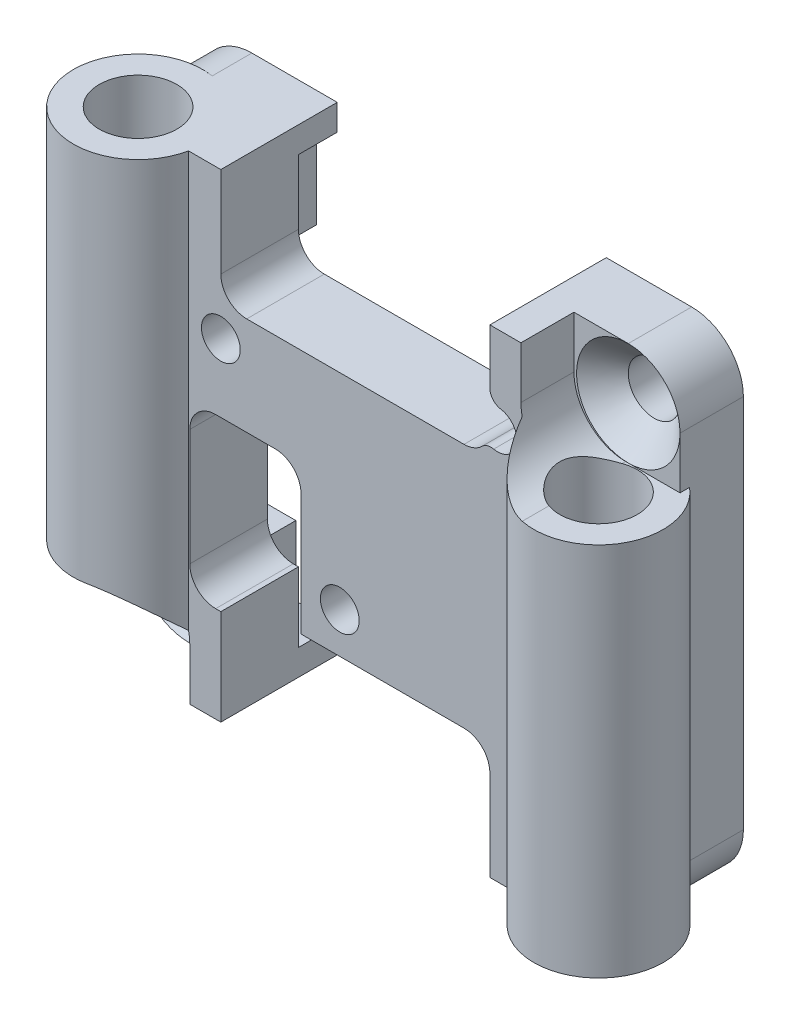
from build123d import *

# Parameters (mm, degrees)
BOSS_EXTRUDE1_DEPTH          = 1.5
BOSS_EXTRUDE1_2_DEPTH        = 1.5
BOSS_EXTRUDE2_DEPTH          = 3
FILLET1_R                    = 1
SKETCH3_R                    = 0.75
CUT_EXTRUDE2_DEPTH           = 29.346075566
FILLET2_R                    = 0.5
BOSS_EXTRUDE3_REACH          = 30.346
SKETCH4_R                    = 2.5
SKETCH4_R_2                  = 1.5
CUT_EXTRUDE3_DEPTH           = 29.731515957
CUT_EXTRUDE5_START           = -4
CUT_EXTRUDE5_DEPTH           = 4
SKETCH7_R                    = 1
CUT_EXTRUDE6_DEPTH           = 29.952763407
CHAMFER1_SIZE                = 1
CIRPATTERN1_COUNT            = 2
CHAMFER1_OF_CIRPATTERN1_SIZE = 1
FILLET3_R                    = 2


# Some blends are built 0.0001 mm under size
with BuildPart() as part:
    # Sketch1 → Boss-Extrude1 (new body)
    with BuildSketch(Plane.XY):
        with BuildLine():
            Line((2, 0), (5.3, 0))
            Line((5.3, 0), (5.3, 1))
            Line((5.3, 1), (3.7, 1))
            Line((3.7, 1), (3.7, 3.7))
            Line((3.7, 3.7), (1, 3.7))
            Line((1, 3.7), (1, 14))
            Line((1, 14), (4.5, 14))
            Line((4.5, 14), (4.5, 17.5))
            Line((4.5, 17.5), (5.3, 17.5))
            Line((5.3, 17.5), (5.3, 18.5))
            Line((5.3, 18.5), (2, 18.5))
            ThreePointArc((2, 18.5), (0.585786438, 17.914213562), (0, 16.5))
            Line((0, 16.5), (0, 2))
            ThreePointArc((0, 2), (0.585786438, 0.585786438), (2, 0))
        make_face()
    extrude(amount=BOSS_EXTRUDE1_DEPTH)



with BuildPart() as body_2:
    # Sketch1 → Boss-Extrude1 2 (new body)
    with BuildSketch(Plane.XY):
        with BuildLine():
            Line((21, 2), (21, 16.5))
            ThreePointArc((21, 16.5), (20.414213562, 17.914213562), (19, 18.5))
            Line((19, 18.5), (15.7, 18.5))
            Line((15.7, 18.5), (15.7, 17.5))
            Line((15.7, 17.5), (16.5, 17.5))
            Line((16.5, 17.5), (16.5, 14))
            Line((16.5, 14), (20, 14))
            Line((20, 14), (20, 2))
            ThreePointArc((20, 2), (19.707106781, 1.292893219), (19, 1))
            Line((19, 1), (15.7, 1))
            Line((15.7, 1), (15.7, 0))
            Line((15.7, 0), (19, 0))
            ThreePointArc((19, 0), (20.414213562, 0.585786438), (21, 2))
        make_face()
    extrude(amount=BOSS_EXTRUDE1_2_DEPTH)


with BuildPart() as part_1:
    add(part.part)

    add(body_2.part)  # Boss-Extrude2 merges body 2
    # Sketch2 → Boss-Extrude2 (add)
    with BuildSketch(Plane.XY.offset(1.5)):
        with BuildLine():
            Line((19, 18.5), (15.7, 18.5))
            Line((15.7, 18.5), (15.7, 14))
            Line((15.7, 14), (5.3, 14))
            Line((5.3, 14), (5.3, 18.5))
            Line((5.3, 18.5), (2, 18.5))
            ThreePointArc((2, 18.5), (0.585786438, 17.914213562), (0, 16.5))
            Line((0, 16.5), (0, 2))
            ThreePointArc((0, 2), (0.585786438, 0.585786438), (2, 0))
            Line((2, 0), (5.3, 0))
            Line((5.3, 0), (5.3, 3.7))
            Line((5.3, 3.7), (4.1, 3.7))
            Line((4.1, 3.7), (4.1, 10.2))
            Line((4.1, 10.2), (8.4, 10.2))
            Line((8.4, 10.2), (8.4, 4.5))
            Line((8.4, 4.5), (15.7, 4.5))
            Line((15.7, 4.5), (15.7, 0))
            Line((15.7, 0), (19, 0))
            ThreePointArc((19, 0), (20.414213562, 0.585786438), (21, 2))
            Line((21, 2), (21, 16.5))
            ThreePointArc((21, 16.5), (20.414213562, 17.914213562), (19, 18.5))
        make_face()
    extrude(amount=BOSS_EXTRUDE2_DEPTH)

    # Fillet1
    fillet1_edges = [part_1.edges().sort_by_distance(p)[0] for p in [
        (15.7, 14, 3),
        (5.3, 14, 3),
        (4.1, 3.7, 3),
        (4.1, 10.2, 3),
        (8.4, 10.2, 3),
        (15.7, 4.5, 3),
    ]]
    fillet(fillet1_edges, radius=FILLET1_R)

    # Sketch3 → Cut-Extrude2 (cut, through all)
    with BuildSketch(Plane.XY.offset(4.5)):
        with Locations((9.898564471, 6.065663219)):
            Circle(SKETCH3_R)
        with Locations((5.3005196, 12.837006018)):
            Circle(SKETCH3_R)
        with Locations((16, 15.15)):
            Circle(SKETCH3_R)
    extrude(amount=-CUT_EXTRUDE2_DEPTH, mode=Mode.SUBTRACT)

    # Fillet2
    fillet2_edges = [part_1.edges().sort_by_distance(p)[0] for p in [
        (15.581422532, 14.527671386, 3),
        (15.7, 15.837386354, 3),
    ]]
    fillet(fillet2_edges, radius=FILLET2_R)

    # Boss-Extrude3: up to this face of the body (flat: up to its plane)
    boss_extrude3_end = Plane(part_1.part.faces().sort_by_distance((3.65, 18.5, 2.25))[0])
    # Sketch4 → Boss-Extrude3 (add, up to the picked face)
    with BuildSketch(Plane.XZ, mode=Mode.PRIVATE) as boss_extrude3_sk1:
        with Locations((1.6, 4)):
            Circle(SKETCH4_R)
        with Locations((1.6, 4)):
            Circle(SKETCH4_R_2, mode=Mode.SUBTRACT)
    boss_extrude3_tool1 = split(extrude(boss_extrude3_sk1.sketch, amount=-BOSS_EXTRUDE3_REACH, mode=Mode.PRIVATE), bisect_by=boss_extrude3_end, keep=Keep.BOTH, mode=Mode.PRIVATE)
    boss_extrude3 = boss_extrude3_tool1.solids().sort_by(Axis((-0.829289, 0, 4), (0, 1, 0)))[0]
    add(boss_extrude3)

    # Sketch4<2> → Cut-Extrude3 (cut, through all)
    with BuildSketch(Plane.XZ):
        with BuildLine():
            Line((2, 4.5), (3.014213562, 4.5))
            ThreePointArc((3.014213562, 4.5), (0.269863345, 4.693351628), (2, 2.554316771))
            Line((2, 2.554316771), (2, 4.5))
        make_face()
        with BuildLine():
            ThreePointArc((3.1, 4), (3.078397839, 4.253652968), (3.014213562, 4.5))
            Line((3.014213562, 4.5), (2, 4.5))
            Line((2, 4.5), (2, 2.554316771))
            ThreePointArc((2, 2.554316771), (2.793733639, 3.091704894), (3.1, 4))
        make_face()
    cut_extrude3 = extrude(amount=-CUT_EXTRUDE3_DEPTH, mode=Mode.SUBTRACT)

    # Mirror1: Boss-Extrude3, Cut-Extrude3 across plane
    add(boss_extrude3.mirror(Plane.ZY.offset(-10.5)))
    add(cut_extrude3.mirror(Plane.ZY.offset(-10.5)), mode=Mode.SUBTRACT)

    # Sketch6 → Cut-Extrude5 (cut)
    with BuildSketch(Plane(origin=(0, 18.5, 0), x_dir=(1, 0, 0), z_dir=(0, 1, 0)).offset(CUT_EXTRUDE5_START)):
        with BuildLine():
            Line((21.9, -2.45), (16.9, -2.45))
            Line((16.9, -2.45), (16.9, -4.5))
            Line((16.9, -4.5), (17.092307692, -4.961538462))
            ThreePointArc((17.092307692, -4.961538462), (19.890290338, -6.451451689), (21.9, -4))
            Line((21.9, -4), (21.9, -2.45))
        make_face()
    cut_extrude5 = extrude(amount=CUT_EXTRUDE5_DEPTH, mode=Mode.SUBTRACT)

    # Sketch7 → Cut-Extrude6 (cut, symmetric)
    with BuildSketch(Plane.XY.offset(2.45)):
        with Locations((19, 16.5)):
            Circle(SKETCH7_R)
        with BuildLine():
            Line((21, 14.5), (21, 16.5))
            ThreePointArc((21, 16.5), (20.414213562, 17.914213562), (19, 18.5))
            Line((19, 18.5), (16.9, 18.5))
            Line((16.9, 18.5), (16.9, 19.5))
            Line((16.9, 19.5), (22, 19.5))
            Line((22, 19.5), (22, 14.5))
            Line((22, 14.5), (21, 14.5))
        make_face()
    cut_extrude6 = extrude(amount=CUT_EXTRUDE6_DEPTH, both=True, mode=Mode.SUBTRACT)

    # Chamfer1
    chamfer1_edges = [part_1.edges().sort_by_distance(p)[0] for p in [
        (18, 16.5, 2.45),
    ]]
    chamfer(chamfer1_edges, length=CHAMFER1_SIZE - 0.0001)  # a hair under: the kernel refuses the full size

    # CirPattern1: Cut-Extrude5, Cut-Extrude6 ×2 about axis
    cirpattern1_axis = Axis((10.5, 9.25, 0), (0, 0, 1))
    add([cut_extrude5.rotate(cirpattern1_axis, i * 360 / CIRPATTERN1_COUNT) for i in range(1, CIRPATTERN1_COUNT)], mode=Mode.SUBTRACT)
    add([cut_extrude6.rotate(cirpattern1_axis, i * 360 / CIRPATTERN1_COUNT) for i in range(1, CIRPATTERN1_COUNT)], mode=Mode.SUBTRACT)

    # Chamfer1 of CirPattern1
    chamfer1_of_cirpattern1_edges = [part_1.edges().sort_by_distance(p)[0] for p in [
        (3, 2, 2.45),
    ]]
    chamfer(chamfer1_of_cirpattern1_edges, length=CHAMFER1_OF_CIRPATTERN1_SIZE - 0.0001)  # a hair under: the kernel refuses the full size

    # Fillet3
    # the kernel refuses this fillet: 2 mm, written as the material it adds along each edge
    with BuildSketch(Plane(origin=(4.1, 4, -2.55), x_dir=(-1, 0, 0), z_dir=(0, 0, 1))) as fillet3_piece_1_section:
        with BuildLine():
            CenterArc((FILLET3_R, FILLET3_R), FILLET3_R, 180, 90)
            Line((0, FILLET3_R), (0, 0))
            Line((0, 0), (FILLET3_R, 0))
        make_face()
    fillet3_piece_1 = extrude(amount=7.05, mode=Mode.PRIVATE)
    fillet3_piece_1 = split(fillet3_piece_1, bisect_by=Plane(origin=(3.649361997, 3.29823616, 1.5), z_dir=(0, 0, 1)), keep=Keep.TOP, mode=Mode.PRIVATE)
    fillet3_piece_1 = fillet3_piece_1 - Plane(origin=(1.6, 3.29823616, 4), x_dir=(1, 0, 0), z_dir=(0, -1, 0)) * Cylinder(1.5, 23, mode=Mode.PRIVATE)
    add(fillet3_piece_1)
    with BuildSketch(Plane(origin=(4.1, 4, -2.55), x_dir=(-1, 0, 0), z_dir=(0, 0, 1))) as fillet3_piece_2_section:
        with BuildLine():
            CenterArc((FILLET3_R, FILLET3_R), FILLET3_R, 180, 90)
            Line((0, FILLET3_R), (0, 0))
            Line((0, 0), (FILLET3_R, 0))
        make_face()
    fillet3_piece_2 = extrude(amount=12.05, mode=Mode.PRIVATE)
    fillet3_piece_2 = fillet3_piece_2 & Plane(origin=(1.6, 3.552217846, 4), x_dir=(1, 0, 0), z_dir=(0, -1, 0)) * Cylinder(2.5, 33, mode=Mode.PRIVATE)
    fillet3_piece_2 = fillet3_piece_2 - Plane(origin=(1.6, 3.552217846, 4), x_dir=(1, 0, 0), z_dir=(0, -1, 0)) * Cylinder(1.5, 33, mode=Mode.PRIVATE)
    add(fillet3_piece_2)
    with BuildSketch(Plane(origin=(16.9, 14.5, 2.45), x_dir=(0, 1, 0), z_dir=(0, 0, 1))) as fillet3_piece_3_section:
        with BuildLine():
            CenterArc((FILLET3_R, -FILLET3_R), FILLET3_R, 90, 90)
            Line((0, -FILLET3_R), (0, 0))
            Line((0, 0), (FILLET3_R, 0))
        make_face()
    fillet3_piece_3 = extrude(amount=2.05, mode=Mode.PRIVATE)
    fillet3_piece_3 = fillet3_piece_3 - Plane(origin=(19.4, 16.248723261, 4), x_dir=(-1, 0, 0), z_dir=(0, -1, 0)) * Cylinder(1.5, 13, mode=Mode.PRIVATE)
    add(fillet3_piece_3)
    with BuildSketch(Plane(origin=(16.9, 14.5, -2.55), x_dir=(0, 1, 0), z_dir=(0, 0, 1))) as fillet3_piece_4_section:
        with BuildLine():
            CenterArc((FILLET3_R, -FILLET3_R), FILLET3_R, 90, 90)
            Line((0, -FILLET3_R), (0, 0))
            Line((0, 0), (FILLET3_R, 0))
        make_face()
    fillet3_piece_4 = extrude(amount=12.05, mode=Mode.PRIVATE)
    fillet3_piece_4 = fillet3_piece_4 & Plane(origin=(19.4, 14.798670753, 4), x_dir=(-1, 0, 0), z_dir=(0, -1, 0)) * Cylinder(2.5, 33, mode=Mode.PRIVATE)
    fillet3_piece_4 = fillet3_piece_4 - Plane(origin=(19.4, 14.798670753, 4), x_dir=(-1, 0, 0), z_dir=(0, -1, 0)) * Cylinder(1.5, 33, mode=Mode.PRIVATE)
    add(fillet3_piece_4)


solid = part_1.part
